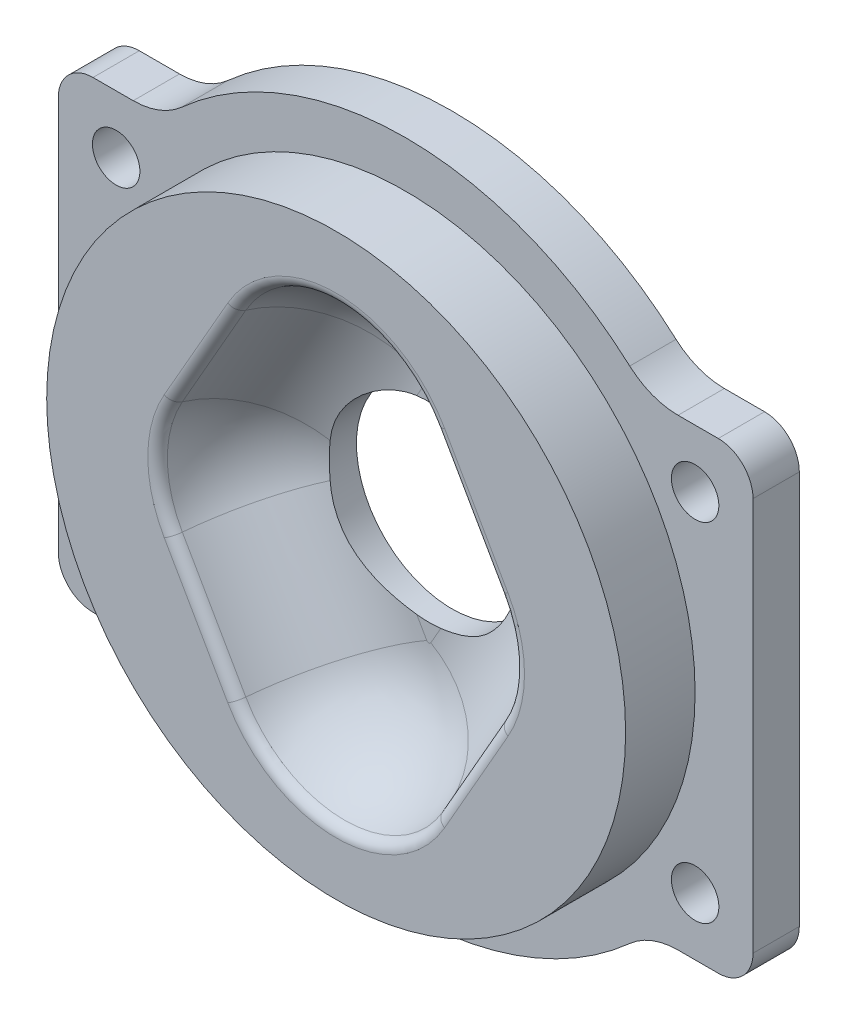
from build123d import *

# Parameters (mm, degrees)
SKETCH1_R           = 15
BOSS_EXTRUDE1_DEPTH = 5
CUT_EXTRUDE1_DEPTH  = 4
FILLET1_R           = 5
FILLET2_R           = 5
SKETCH4_R           = 4.125
CUT_EXTRUDE2_DEPTH  = 22.794494718
SKETCH7_R           = 15
SKETCH7_R_2         = 12.5
CUT_EXTRUDE3_DEPTH  = 22.794494741
BOSS_EXTRUDE4_START = -2
SKETCH10_R          = 1.025
BOSS_EXTRUDE4_DEPTH = 2
FILLET5_R           = 1.5
BOSS_EXTRUDE5_START = -2
BOSS_EXTRUDE5_DEPTH = 2
FILLET6_R           = 3.125
FILLET7_R           = 0.5


with BuildPart() as part:
    # Sketch1 → Boss-Extrude1 (new body)
    with BuildSketch(Plane.XY):
        Circle(SKETCH1_R)
    extrude(amount=-BOSS_EXTRUDE1_DEPTH)

    # Sketch3 → Cut-Extrude1 (cut)
    with BuildSketch(Plane.XY):
        Polygon((8.5, 0), (0, 14.875), (-8.5, 0), (0, -14.875), align=None)
    extrude(amount=-CUT_EXTRUDE1_DEPTH, mode=Mode.SUBTRACT)

    # Fillet1
    fillet1_edges = [part.edges().sort_by_distance(p)[0] for p in [
        (0, 14.875, -2),
        (8.5, 0, -2),
        (0, -14.875, -2),
        (-8.5, 0, -2),
    ]]
    fillet(fillet1_edges, radius=FILLET1_R)

    # Fillet2
    # the kernel refuses this fillet: 5 mm, written as the material it adds along each edge
    with BuildSketch(Plane(origin=(0, -4.797177815, -4), x_dir=(-0.8682431421244594, -0.4961389383568335, 0), z_dir=(-0.4961389383568335, 0.8682431421244594, 0))) as fillet2_piece_1:
        with BuildLine():
            CenterArc((0.101020514, 5), FILLET2_R, 270, 78.463040967)
            Line((0.101020514, 0), (0.101020514, -0.1))
            Line((0.101020514, -0.1), (5, -0.1))
            Line((5, -0.1), (5.1, 0))
            ThreePointArc((5.1, 0), (5.1, 2), (5.09797959, 3.98))
            Line((5.09797959, 3.98), (5, 4))
        make_face()
    revolve(axis=Axis((0, -4.797177815, -4), (0, 0, 1)), revolution_arc=120.510237406)
    with BuildSketch(Plane(origin=(-7.082460176, -2.480694692, -4), x_dir=(1.3436192329677e-12, 7.677824188386856e-13, 1.0), z_dir=(0.49613893835683387, -0.8682431421244593, 0)), Plane(origin=(-4.341215711, 7.277872506, -4), x_dir=(1.3880008253859177e-12, -7.93143328791953e-13, 1.0), z_dir=(-0.49613893835683387, -0.8682431421244591, 0)), Plane(origin=(7.082460176, 2.480694692, -4), x_dir=(-1.3700903659455922e-12, -7.829087805403382e-13, 1.0), z_dir=(-0.49613893835683376, 0.8682431421244593, 0)), Plane(origin=(4.341215711, -7.277872506, -4), x_dir=(-1.3859204382413136e-12, 7.919545361378934e-13, 1.0), z_dir=(0.49613893835683387, 0.8682431421244593, 0))) as fillet2_piece_2:
        with BuildLine():
            CenterArc((5, -4.898979486), FILLET2_R, 101.536959033, 78.463040967)
            Line((0, -4.898979486), (-0.1, -4.898979486))
            Line((-0.1, -4.898979486), (-0.1, 0))
            Line((-0.1, 0), (0, 0.1))
            ThreePointArc((0, 0.1), (2, 0.1), (3.98, 0.09797959))
            Line((3.98, 0.09797959), (4, 0))
        make_face()
    extrude(amount=5.525154858)
    with BuildSketch(Plane(origin=(-2.741244466, 0, -4), x_dir=(-0.8682431421244594, 0.4961389383568336, 0), z_dir=(0.4961389383568336, 0.8682431421244594, 0))) as fillet2_piece_3:
        with BuildLine():
            CenterArc((0.101020514, 5), FILLET2_R, 270, 78.463040967)
            Line((0.101020514, 0), (0.101020514, -0.1))
            Line((0.101020514, -0.1), (5, -0.1))
            Line((5, -0.1), (5.1, 0))
            ThreePointArc((5.1, 0), (5.1, 2), (5.09797959, 3.98))
            Line((5.09797959, 3.98), (5, 4))
        make_face()
    revolve(axis=Axis((-2.741244466, 0, -4), (0, 0, 1)), revolution_arc=59.489762594)
    with BuildSketch(Plane(origin=(0, 4.797177815, -4), x_dir=(0.8682431421244594, 0.4961389383568332, 0), z_dir=(0.4961389383568332, -0.8682431421244594, 0))) as fillet2_piece_4:
        with BuildLine():
            CenterArc((0.101020514, 5), FILLET2_R, 270, 78.463040967)
            Line((0.101020514, 0), (0.101020514, -0.1))
            Line((0.101020514, -0.1), (5, -0.1))
            Line((5, -0.1), (5.1, 0))
            ThreePointArc((5.1, 0), (5.1, 2), (5.09797959, 3.98))
            Line((5.09797959, 3.98), (5, 4))
        make_face()
    revolve(axis=Axis((0, 4.797177815, -4), (0, 0, 1)), revolution_arc=120.510237406)
    with BuildSketch(Plane(origin=(2.741244466, 0, -4), x_dir=(0.8682431421244592, 0.49613893835683376, 0), z_dir=(-0.49613893835683376, 0.8682431421244592, 0))) as fillet2_piece_5:
        with BuildLine():
            CenterArc((0.101020514, -5), FILLET2_R, 11.536959033, 78.463040967)
            Line((0.101020514, 0), (0.101020514, 0.1))
            Line((0.101020514, 0.1), (5, 0.1))
            Line((5, 0.1), (5.1, 0))
            ThreePointArc((5.1, 0), (5.1, -2), (5.09797959, -3.98))
            Line((5.09797959, -3.98), (5, -4))
        make_face()
    revolve(axis=Axis((2.741244466, 0, -4), (0, 0, -1)), revolution_arc=59.489762594)

    # Sketch4 → Cut-Extrude2 (cut, through all)
    with BuildSketch(Plane.XY):
        Circle(SKETCH4_R)
    extrude(amount=-CUT_EXTRUDE2_DEPTH, mode=Mode.SUBTRACT)

    # Sketch7 → Cut-Extrude3 (cut, through all)
    with BuildSketch(Plane.XY):
        Circle(SKETCH7_R)
        Circle(SKETCH7_R_2, mode=Mode.SUBTRACT)
    extrude(amount=-CUT_EXTRUDE3_DEPTH, mode=Mode.SUBTRACT)

    # Sketch10 → Boss-Extrude4 (add)
    # profile 1 of 2: a face of its own
    with BuildSketch(Plane(origin=(0, 0, -5), x_dir=(-1, 0, 0), z_dir=(0, 0, -1)).offset(BOSS_EXTRUDE4_START)):
        with BuildLine():
            Line((15, 10), (7.5, 10))
            ThreePointArc((7.5, 10), (11.180339887, 5.590169944), (12.5, 0))
            ThreePointArc((12.5, 0), (11.180339887, -5.590169944), (7.5, -10))
            Line((7.5, -10), (15, -10))
            Line((15, -10), (15, 10))
        make_face()
        with Locations((12.5, -7.5)):
            Circle(SKETCH10_R, mode=Mode.SUBTRACT)
        with Locations((12.5, 7.5)):
            Circle(SKETCH10_R, mode=Mode.SUBTRACT)
    # profile 2 of 2: a face of its own
    with BuildSketch(Plane(origin=(0, 0, -5), x_dir=(-1, 0, 0), z_dir=(0, 0, -1)).offset(BOSS_EXTRUDE4_START)):
        with BuildLine():
            Line((-7.5, 10), (-15, 10))
            Line((-15, 10), (-15, -10))
            Line((-15, -10), (-7.5, -10))
            ThreePointArc((-7.5, -10), (-12.5, 0), (-7.5, 10))
        make_face()
        with Locations((-12.5, -7.5)):
            Circle(SKETCH10_R, mode=Mode.SUBTRACT)
        with Locations((-12.5, 7.5)):
            Circle(SKETCH10_R, mode=Mode.SUBTRACT)
    extrude(amount=BOSS_EXTRUDE4_DEPTH)

    # Fillet5
    fillet5_edges = [part.edges().sort_by_distance(p)[0] for p in [
        (15, -10, -4),
        (15, 10, -4),
        (-15, 10, -4),
        (-15, -10, -4),
    ]]
    fillet(fillet5_edges, radius=FILLET5_R)

    # Sketch11 → Boss-Extrude5 (add)
    with BuildSketch(Plane(origin=(0, 0, -5), x_dir=(-1, 0, 0), z_dir=(0, 0, -1)).offset(BOSS_EXTRUDE5_START)):
        with BuildLine():
            ThreePointArc((-7.5, 10), (0, 12.5), (7.5, 10))
            Line((7.5, 10), (10.5, 10))
            ThreePointArc((10.5, 10), (0, 14.5), (-10.5, 10))
            Line((-10.5, 10), (-7.5, 10))
        make_face()
        with BuildLine():
            Line((10.5, -10), (7.5, -10))
            ThreePointArc((7.5, -10), (0, -12.5), (-7.5, -10))
            Line((-7.5, -10), (-10.5, -10))
            ThreePointArc((-10.5, -10), (0, -14.5), (10.5, -10))
        make_face()
    extrude(amount=BOSS_EXTRUDE5_DEPTH)

    # Fillet6
    fillet6_edges = [part.edges().sort_by_distance(p)[0] for p in [
        (-10.5, 10, -4),
        (10.5, 10, -4),
        (10.5, -10, -4),
        (-10.5, -10, -4),
    ]]
    fillet(fillet6_edges, radius=FILLET6_R)

    # Fillet7
    fillet7_edges = [part.edges().sort_by_distance(p)[0] for p in [
        (5.711837943, 4.879283599, 0),
        (5.711837943, -4.879283599, 0),
        (-5.711837943, -4.879283599, 0),
        (-5.711837943, 4.879283599, 0),
        (7.741244466, 0, 0),
        (0, -9.797177815, 0),
        (-7.741244466, 0, 0),
        (0, 9.797177815, 0),
    ]]
    fillet(fillet7_edges, radius=FILLET7_R)


solid = part.part
